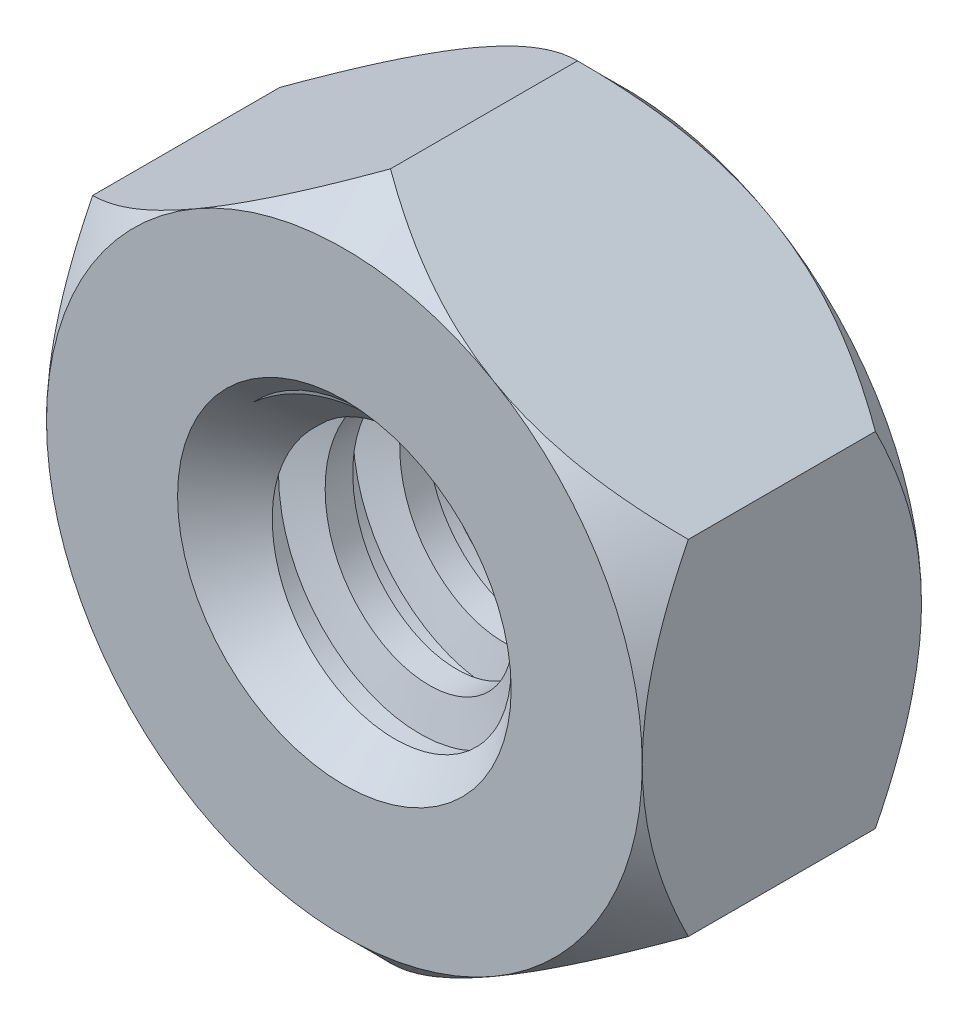
from build123d import *

# Parameters (mm, degrees)
SKETCH1_R           = 3.175
BOSS_EXTRUDE1_DEPTH = 2.9765625
SWEEP1_PITCH        = 1.5875
SKETCH4_R           = 3.556
CUT_EXTRUDE1_DEPTH  = 13.28609104
SKETCH5_R           = 3.556
CUT_EXTRUDE2_DEPTH  = 12.380928544
SKETCH6_OUTSIDE_W   = 43.52
SKETCH6_OUTSIDE_H   = 45.484
SKETCH6_OUTSIDE_R   = 6.35
CUT_EXTRUDE5_DEPTH  = 12.380928424
CUT_EXTRUDE5_DRAFT  = -45
SKETCH7_OUTSIDE_W   = 43.52
SKETCH7_OUTSIDE_H   = 45.484
SKETCH7_OUTSIDE_R   = 6.35
CUT_EXTRUDE6_DEPTH  = 12.380928424
CUT_EXTRUDE6_DRAFT  = -45


with BuildPart() as part:
    # Sketch1 → Boss-Extrude1 (new, symmetric)
    with BuildSketch(Plane.XY):
        Polygon((0, -7.332348419), (6.35, -3.666174209), (6.35, 3.666174209), (0, 7.332348419), (-6.35, 3.666174209), (-6.35, -3.666174209), align=None)
        Circle(SKETCH1_R, mode=Mode.SUBTRACT)
    extrude(amount=BOSS_EXTRUDE1_DEPTH, both=True)

    # Sweep1: the profile of Sketch3 profile screwed along a right-hand helix of 4.75 turns, 8 arcs to a turn; built about Z, then put on its axis
    sweep1_z = Axis((0, 0, 0), (0, 0, 1))
    sweep1_corners = [(3.1753, 0, 7.7585e-05), (2.38130397, 0, -0.20526375), (2.38130397, 0, -0.79375), (3.1753, 0, -0.999091335)]
    with BuildLine(mode=Mode.PRIVATE) as sweep1_profile:
        Line(sweep1_corners[0], sweep1_corners[1])
        Line(sweep1_corners[1], sweep1_corners[2])
        Line(sweep1_corners[2], sweep1_corners[3])
        Line(sweep1_corners[3], sweep1_corners[0])
    sweep1_cap = Face(sweep1_profile.wire())
    sweep1_turn_angles = [0, 22.5, 45, 67.5, 90, 112.5, 135, 157.5, 180, 202.5, 225, 247.5, 270, 292.5, 315, 337.5, 360]
    sweep1_turn_weights = [1, 0.9238795325112867, 1, 0.9238795325112867, 1, 0.9238795325112867, 1, 0.9238795325112867, 1, 0.9238795325112867, 1, 0.9238795325112867, 1, 0.9238795325112867, 1, 0.9238795325112867, 1]
    sweep1_turn_rails = [Edge.make_bspline([Vector(p[0], p[1], 0).rotate(sweep1_z, sweep1_turn_angles[k]) / sweep1_turn_weights[k] + Vector(0, 0, p[2] + SWEEP1_PITCH * sweep1_turn_angles[k] / 360) for k in range(17)], [0, 0, 0, 1, 1, 2, 2, 3, 3, 4, 4, 5, 5, 6, 6, 7, 7, 8, 8, 8], 2, sweep1_turn_weights) for p in sweep1_corners]
    sweep1_turn_sides = [Face.make_surface_from_curves(sweep1_turn_rails[p[0]], sweep1_turn_rails[p[1]]) for p in [(0, 1), (1, 2), (2, 3), (3, 0)]]
    sweep1_last_angles = [1440, 1462.5, 1485, 1507.5, 1530, 1552.5, 1575, 1597.5, 1620, 1642.5, 1665, 1687.5, 1710]
    sweep1_last_weights = [1, 0.9238795325112867, 1, 0.9238795325112867, 1, 0.9238795325112867, 1, 0.9238795325112867, 1, 0.9238795325112867, 1, 0.92387953251128, 1]
    sweep1_last_rails = [Edge.make_bspline([Vector(p[0], p[1], 0).rotate(sweep1_z, sweep1_last_angles[k]) / sweep1_last_weights[k] + Vector(0, 0, p[2] + SWEEP1_PITCH * sweep1_last_angles[k] / 360) for k in range(13)], [0, 0, 0, 1, 1, 2, 2, 3, 3, 4, 4, 5, 5, 6, 6, 6], 2, sweep1_last_weights) for p in sweep1_corners]
    sweep1_last_sides = [Face.make_surface_from_curves(sweep1_last_rails[p[0]], sweep1_last_rails[p[1]]) for p in [(0, 1), (1, 2), (2, 3), (3, 0)]]
    sweep1 = Plane(origin=(0, 0, 2.9765625), x_dir=(0, 1, 0), z_dir=(0, 0, -1)) * Solid(Shell([*[p.moved(Location((0, 0, SWEEP1_PITCH * i))) for i in range(4) for p in sweep1_turn_sides], *sweep1_last_sides, sweep1_cap, sweep1_cap.rotate(sweep1_z, 1710).moved(Location((0, 0, SWEEP1_PITCH * 1710 / 360)))]))
    add(sweep1)

    # Sketch4 → Cut-Extrude1 (cut, through all)
    with BuildSketch(Plane.XY.offset(2.9765625)):
        Circle(SKETCH4_R)
    extrude(amount=CUT_EXTRUDE1_DEPTH, mode=Mode.SUBTRACT)

    # Sketch5 → Cut-Extrude2 (cut, through all)
    with BuildSketch(Plane(origin=(0, 0, -2.9765625), x_dir=(-1, 0, 0), z_dir=(0, 0, -1))):
        Circle(SKETCH5_R)
    extrude(amount=CUT_EXTRUDE2_DEPTH, mode=Mode.SUBTRACT)

    # Cut-Extrude3 cone 1 section (through the dimple's axis) → Cut-Extrude3 (revolve, cut)
    with BuildSketch(Plane(origin=(0, 0, 2.9765625), x_dir=(0, -1, 0), z_dir=(1, 0, 0))):
        Polygon((0, 0), (3.556, 0), (0, 3.556), align=None)
    revolve(axis=Axis((0, 0, 2.9765625), (0, 0, -1)), mode=Mode.SUBTRACT)

    # Cut-Extrude4 cone 1 section (through the dimple's axis) → Cut-Extrude4 (revolve, cut)
    with BuildSketch(Plane(origin=(0, 0, -2.9765625), x_dir=(0, 1, 0), z_dir=(1, 0, 0))):
        Polygon((0, 0), (3.556, 0), (0, 3.556), align=None)
    revolve(axis=Axis((0, 0, -2.9765625), (0, 0, 1)), mode=Mode.SUBTRACT)


with BuildPart() as cut_extrude5_tool:
    # Sketch6 outside → Cut-Extrude5 (with draft: the straight prism first)
    with BuildSketch(Plane.XY.offset(2.9765625)):
        Rectangle(SKETCH6_OUTSIDE_W, SKETCH6_OUTSIDE_H)
        Circle(SKETCH6_OUTSIDE_R, mode=Mode.SUBTRACT)
    extrude(amount=-CUT_EXTRUDE5_DEPTH)
    # Cut-Extrude5: the draft: its side faces are tilted about the plane it starts from
    cut_extrude5_sides = [cut_extrude5_tool.faces().sort_by_distance(p)[0] for p in [
        (0, -22.742, -3.213901712),
        (21.76, 0, -3.213901712),
        (0, 22.742, -3.213901712),
        (-21.76, 0, -3.213901712),
        (-6.35, 0, -3.213901712),
    ]]
    draft(cut_extrude5_sides, Plane.XY.offset(2.9765625), CUT_EXTRUDE5_DRAFT)


with BuildPart() as part_1:
    add(part.part)

    # Cut-Extrude5: cut by cut_extrude5_tool
    add(cut_extrude5_tool.part, mode=Mode.SUBTRACT)


with BuildPart() as cut_extrude6_tool:
    # Sketch7 outside → Cut-Extrude6 (with draft: the straight prism first)
    with BuildSketch(Plane(origin=(0, 0, -2.9765625), x_dir=(-1, 0, 0), z_dir=(0, 0, -1))):
        Rectangle(SKETCH7_OUTSIDE_W, SKETCH7_OUTSIDE_H)
        Circle(SKETCH7_OUTSIDE_R, mode=Mode.SUBTRACT)
    extrude(amount=-CUT_EXTRUDE6_DEPTH)
    # Cut-Extrude6: the draft: its side faces are tilted about the plane it starts from
    cut_extrude6_sides = [cut_extrude6_tool.faces().sort_by_distance(p)[0] for p in [
        (0, -22.742, 3.213901712),
        (-21.76, 0, 3.213901712),
        (0, 22.742, 3.213901712),
        (21.76, 0, 3.213901712),
        (6.35, 0, 3.213901712),
    ]]
    draft(cut_extrude6_sides, Plane(origin=(0, 0, -2.9765625), x_dir=(-1, 0, 0), z_dir=(0, 0, -1)), CUT_EXTRUDE6_DRAFT)


with BuildPart() as part_2:
    add(part_1.part)

    # Cut-Extrude6: cut by cut_extrude6_tool
    add(cut_extrude6_tool.part, mode=Mode.SUBTRACT)


solid = part_2.part
